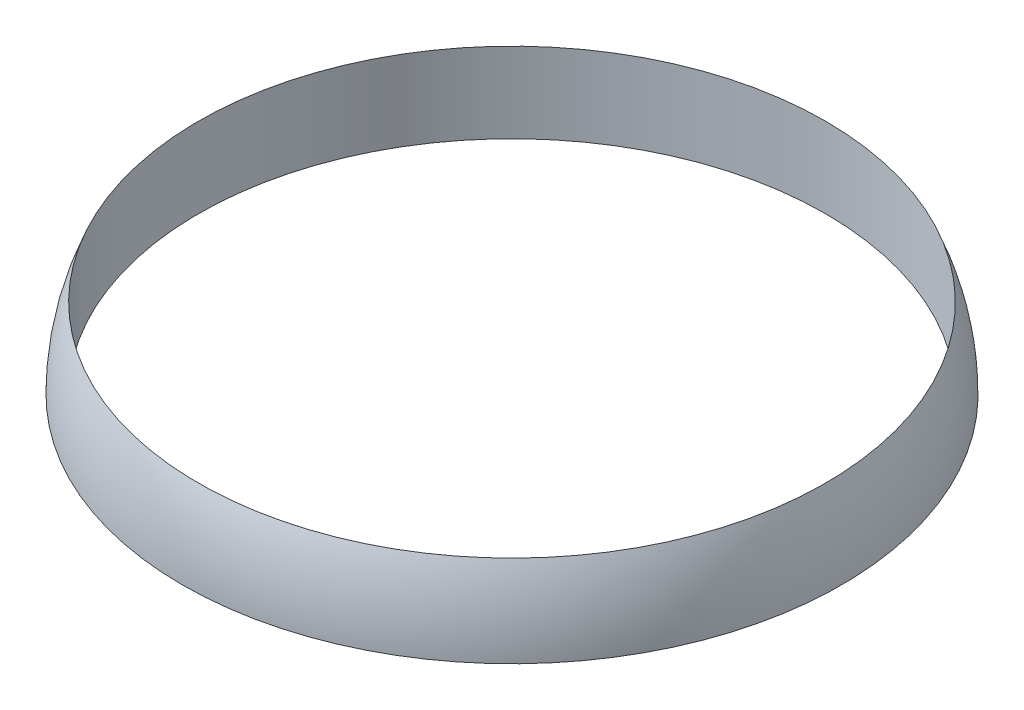
from build123d import *


with BuildPart() as part:
    # Sketch1 → Revolve1 (revolve)
    with BuildSketch(Plane(origin=(0, 0, 0), x_dir=(0, 0, -1), z_dir=(1, 0, 0))):
        with BuildLine():
            Line((78.2, 0), (78.2, 20))
            ThreePointArc((78.2, 20), (81.190195136, 10.198039027), (82.2, 0))
            Line((82.2, 0), (78.2, 0))
        make_face()
    revolve(axis=Axis((0, 0, 0), (0, 1, 0)))


solid = part.part
